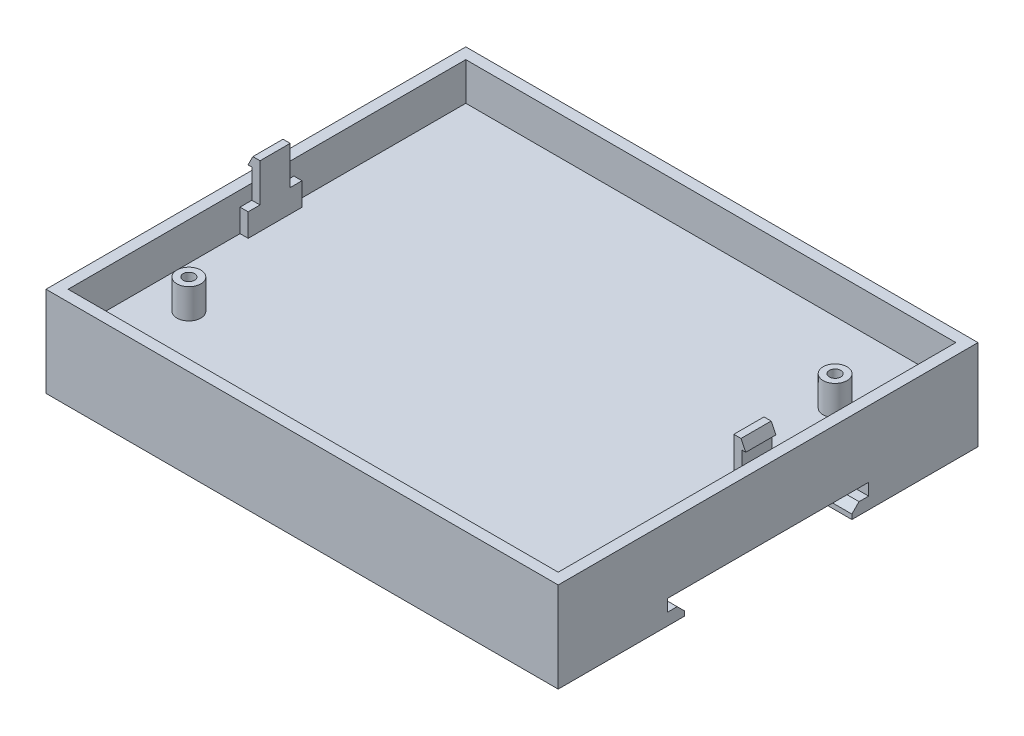
from build123d import *

# Parameters (mm, degrees)
SKETCH1_W                = 107
SKETCH1_H                = 87.7
BOSS_EXTRUDE1_DEPTH      = 13.85
SKETCH2_W                = 102.38
SKETCH2_H                = 83.08
CUT_EXTRUDE1_DEPTH       = 7.9
SKETCH4_R                = 2.5
SKETCH4_R_2              = 1.2
BOSS_EXTRUDE2_DEPTH      = 6.2
SKETCH7_W                = 11.25
SKETCH7_H                = 4.8
BOSS_EXTRUDE3_DEPTH      = 1.7
BOSS_EXTRUDE4_DEPTH      = 3.15
SKETCH9_W                = 12.045425082
SKETCH9_H                = 7.003710523
BOSS_EXTRUDE9_DEPTH      = 5
SKETCH14_W               = 3.501855262
SKETCH14_H               = 2.5
CUT_EXTRUDE6_DEPTH       = 118.146852284
CHAMFER1_SIZE            = 1.5
CHAMFER1_OF_MIRROR4_SIZE = 1.5
MIRROR5_START            = -53.5
MIRROR5_DEPTH            = 12.045425082
BOSS_EXTRUDE10_DEPTH     = 5


# Read off the part's stored shape, not the designer's step: Mirror5
with BuildPart() as part:
    # Sketch1 → Boss-Extrude1 (new body)
    with BuildSketch(Plane(origin=(0, 0, 0), x_dir=(1, 0, 0), z_dir=(0, 1, 0))):
        Rectangle(SKETCH1_W, SKETCH1_H)
    extrude(amount=BOSS_EXTRUDE1_DEPTH)

    # Sketch2 → Cut-Extrude1 (cut)
    with BuildSketch(Plane(origin=(0, 13.85, 0), x_dir=(1, 0, 0), z_dir=(0, 1, 0))):
        Rectangle(SKETCH2_W, SKETCH2_H)
    extrude(amount=-CUT_EXTRUDE1_DEPTH, mode=Mode.SUBTRACT)

    # Sketch4 → Boss-Extrude2 (add)
    # profile 1 of 2: a face of its own
    with BuildSketch(Plane(origin=(0, 5.95, 0), x_dir=(1, 0, 0), z_dir=(0, 1, 0))):
        with Locations(Location((-42.5, -25, 0), (0, 0, 90))):
            Circle(SKETCH4_R)
        with Locations(Location((-42.5, -25, 0), (0, 0, 90))):
            Circle(SKETCH4_R_2, mode=Mode.SUBTRACT)
    # profile 2 of 2: a face of its own
    with BuildSketch(Plane(origin=(0, 5.95, 0), x_dir=(1, 0, 0), z_dir=(0, 1, 0))):
        with Locations(Location((42.5, 25, 0), (0, 0, 90))):
            Circle(SKETCH4_R)
        with Locations(Location((42.5, 25, 0), (0, 0, 90))):
            Circle(SKETCH4_R_2, mode=Mode.SUBTRACT)
    extrude(amount=BOSS_EXTRUDE2_DEPTH)

    # Sketch7 → Boss-Extrude3 (add)
    with BuildSketch(Plane(origin=(-51.19, 0, 0), x_dir=(0, 0, -1), z_dir=(1, 0, 0))):
        with Locations((0, 8.35)):
            Rectangle(SKETCH7_W, SKETCH7_H)
    boss_extrude3 = extrude(amount=BOSS_EXTRUDE3_DEPTH)

    # Sketch8 → Boss-Extrude4 (add, symmetric)
    with BuildSketch(Plane.XY):
        Polygon((-49.49, 10.75), (-49.49, 18.75), (-50.99, 18.75), (-51.99, 16.75), (-51.19, 16.75), (-51.19, 10.75), align=None)
    boss_extrude4 = extrude(amount=BOSS_EXTRUDE4_DEPTH, both=True)

    # Mirror1: Boss-Extrude3, Boss-Extrude4 across plane
    add(boss_extrude3.mirror(Plane(origin=(0, 0, 0), x_dir=(0, 0, 1), z_dir=(1, 0, 0))))
    add(boss_extrude4.mirror(Plane(origin=(0, 0, 0), x_dir=(0, 0, 1), z_dir=(1, 0, 0))))

    # Sketch9 → Boss-Extrude9 (add)
    with BuildSketch(Plane.XZ):
        with Locations((47.477287459, -21.001855262)):
            Rectangle(SKETCH9_W, SKETCH9_H)
    boss_extrude9 = extrude(amount=BOSS_EXTRUDE9_DEPTH)

    # Sketch14 → Cut-Extrude6 (cut, through all)
    with BuildSketch(Plane(origin=(53.5, 0, 0), x_dir=(0, 0, -1), z_dir=(1, 0, 0))):
        with Locations((19.250927631, -1.25)):
            Rectangle(SKETCH14_W, SKETCH14_H)
    cut_extrude6 = extrude(amount=-CUT_EXTRUDE6_DEPTH, mode=Mode.SUBTRACT)

    # Chamfer1
    chamfer1_edges = [part.edges().sort_by_distance(p)[0] for p in [
        (47.477287459, -2.5, -17.5),
    ]]
    chamfer(chamfer1_edges, length=CHAMFER1_SIZE)

    # Mirror4: Boss-Extrude9, Cut-Extrude6 across plane
    add(boss_extrude9.mirror(Plane.XY))
    add(cut_extrude6.mirror(Plane.XY), mode=Mode.SUBTRACT)

    # Chamfer1 of Mirror4
    chamfer1_of_mirror4_edges = [part.edges().sort_by_distance(p)[0] for p in [
        (47.477287459, -2.5, 17.5),
    ]]
    chamfer(chamfer1_of_mirror4_edges, length=CHAMFER1_OF_MIRROR4_SIZE)

    # Mirror5 outline → Mirror5 (add)
    with BuildSketch(Plane.YZ.offset(MIRROR5_START)):
        Polygon((-2.5, -19), (-4, -17.5), (-5, -17.5), (-5, -24.503710523), (0, -24.503710523), (0, -21.001855262), (-2.5, -21.001855262), align=None)
        Polygon((-2.5, 21.001855262), (0, 21.001855262), (0, 24.503710523), (-5, 24.503710523), (-5, 17.5), (-4, 17.5), (-2.5, 19), align=None)
    extrude(amount=MIRROR5_DEPTH)

    # Sketch15 → Boss-Extrude10 (add)
    with BuildSketch(Plane(origin=(0, 0, 0), x_dir=(-1, 0, 0), z_dir=(0, -1, 0))):
        Polygon((-47.477287459, 24.503710523), (-47.477287459, 36.197250384), (48.282556023, 36.197250384), (48.282556023, 24.503710523), (53.5, 24.503710523), (53.5, 43.85), (-53.5, 43.85), (-53.5, 24.503710523), align=None)
    boss_extrude10 = extrude(amount=BOSS_EXTRUDE10_DEPTH)

    # Mirror6: Boss-Extrude10 across plane
    add(boss_extrude10.mirror(Plane.XY))


solid = part.part
